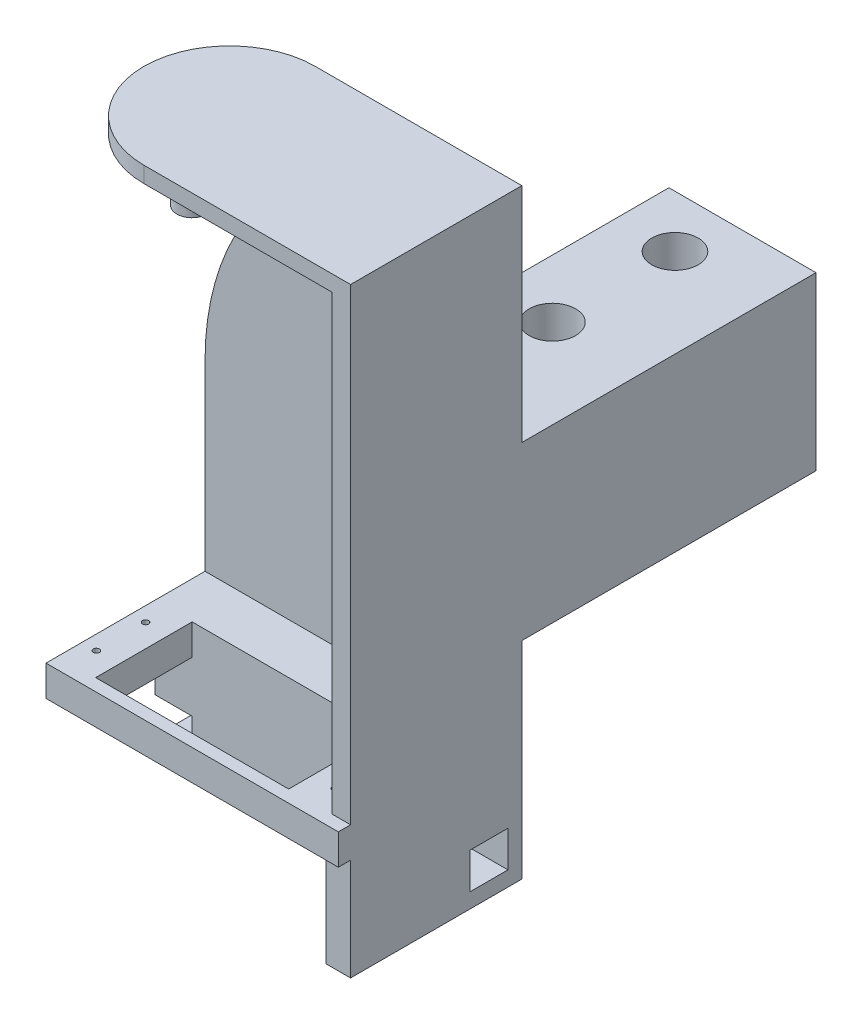
from build123d import *

# Parameters (mm, degrees)
SKETCH1_W            = 55.49400001
SKETCH1_H            = 26.874
BOSS_EXTRUDE1_DEPTH  = 6.35
SKETCH2_W            = 40
SKETCH2_H            = 19
CUT_EXTRUDE1_DEPTH   = 6.35
SKETCH3_R            = 0.635
CUT_EXTRUDE2_DEPTH   = 6.35
SKETCH4_W            = 55.49400001
SKETCH4_H            = 7.874
BOSS_EXTRUDE2_DEPTH  = 21.15
SKETCH6_W            = 7.747000005
SKETCH6_H            = 6.35
BOSS_EXTRUDE3_DEPTH  = 1
SKETCH12_W           = 7.747000005
SKETCH12_H           = 7.475
CUT_EXTRUDE4_DEPTH   = 9.398
SKETCH13_W           = 7.747000005
SKETCH13_H           = 7.9
BOSS_EXTRUDE6_DEPTH  = 20
SKETCH14_W           = 27.874
SKETCH14_H           = 27.5
BOSS_EXTRUDE7_DEPTH  = 5.08
SKETCH16_W           = 3.81
SKETCH16_H           = 27.874
BOSS_EXTRUDE8_DEPTH  = 93.66
BOSS_EXTRUDE9_DEPTH  = 7.62
SKETCH18_W           = 5.08
SKETCH18_H           = 93.66
BOSS_EXTRUDE10_DEPTH = 56.76400001
SKETCH19_W           = 30.48
SKETCH19_H           = 35.56
BOSS_EXTRUDE11_DEPTH = 76.2
SKETCH20_R           = 4.813300002
SKETCH20_R_2         = 4.813299999
CUT_EXTRUDE5_DEPTH   = 76.2
SKETCH21_W           = 30.48
SKETCH21_H           = 35.56
CUT_EXTRUDE6_DEPTH   = 15.24
SKETCH23_W           = 7.876812164
SKETCH23_H           = 7.475
CUT_EXTRUDE7_DEPTH   = 54.102
FILLET1_R            = 55.88
SKETCH24_W           = 3.81
SKETCH24_H           = 35.494
BOSS_EXTRUDE12_DEPTH = 3.302
SKETCH25_W           = 35.494
SKETCH25_H           = 3.302
BOSS_EXTRUDE13_DEPTH = 56.76400001
FILLET2_R            = 17.78
SKETCH26_R           = 3.175
BOSS_EXTRUDE14_DEPTH = 8.89
SKETCH27_W           = 7.747000005
SKETCH27_H           = 20
CUT_EXTRUDE9_DEPTH   = 10.668
SKETCH28_W           = 7.747000005
SKETCH28_H           = 6.35
BOSS_EXTRUDE15_DEPTH = 2.54
SKETCH29_W           = 2.54
SKETCH29_H           = 6.35
BOSS_EXTRUDE16_DEPTH = 47.747000005
SKETCH30_W           = 2.54
SKETCH30_H           = 6.35
BOSS_EXTRUDE17_DEPTH = 5.08


with BuildPart() as part:
    # Sketch1 → Boss-Extrude1 (new body)
    with BuildSketch(Plane(origin=(0, 0, 0), x_dir=(1, 0, 0), z_dir=(0, 1, 0))):
        with Locations((27.747000005, 13.437)):
            Rectangle(SKETCH1_W, SKETCH1_H)
    extrude(amount=BOSS_EXTRUDE1_DEPTH)

    # Sketch2 → Cut-Extrude1 (cut)
    with BuildSketch(Plane(origin=(0, 6.35, 0), x_dir=(1, 0, 0), z_dir=(0, 1, 0))):
        with Locations((27.747000005, 9.5)):
            Rectangle(SKETCH2_W, SKETCH2_H)
    extrude(amount=-CUT_EXTRUDE1_DEPTH, mode=Mode.SUBTRACT)

    # Sketch3 → Cut-Extrude2 (cut)
    with BuildSketch(Plane.XZ):
        with Locations(Location((2.997000004, -14.099999999, 0), (0, 0, 270))):
            Circle(SKETCH3_R)
        with Locations(Location((2.997000004, -3.899999999, 0), (0, 0, 270))):
            Circle(SKETCH3_R)
        with Locations(Location((52.497000004, -14.099999999, 0), (0, 0, 270))):
            Circle(SKETCH3_R)
        with Locations(Location((52.497000004, -3.899999999, 0), (0, 0, 270))):
            Circle(SKETCH3_R)
    extrude(amount=-CUT_EXTRUDE2_DEPTH, mode=Mode.SUBTRACT)

    # Sketch4 → Boss-Extrude2 (add)
    with BuildSketch(Plane.XZ):
        with Locations((27.747000005, -22.937)):
            Rectangle(SKETCH4_W, SKETCH4_H)
    extrude(amount=BOSS_EXTRUDE2_DEPTH)

    # Sketch6 → Boss-Extrude3 (add)
    with BuildSketch(Plane.XY):
        with Locations((3.873500003, 3.175)):
            Rectangle(SKETCH6_W, SKETCH6_H)
        with Locations((51.620500007, 3.175)):
            Rectangle(SKETCH6_W, SKETCH6_H)
    extrude(amount=BOSS_EXTRUDE3_DEPTH)

    # Sketch12 → Cut-Extrude4 (cut)
    with BuildSketch(Plane.XY.offset(-19)):
        with Locations((3.873500003, -14.3125)):
            Rectangle(SKETCH12_W, SKETCH12_H)
    extrude(amount=-CUT_EXTRUDE4_DEPTH, mode=Mode.SUBTRACT)

    # Sketch13 → Boss-Extrude6 (add)
    with BuildSketch(Plane.XY.offset(-19)):
        with Locations((51.620500007, -17.2)):
            Rectangle(SKETCH13_W, SKETCH13_H)
    extrude(amount=BOSS_EXTRUDE6_DEPTH)

    # Sketch14 → Boss-Extrude7 (add)
    with BuildSketch(Plane(origin=(55.49400001, 0, 0), x_dir=(0, 0, -1), z_dir=(1, 0, 0))):
        with Locations((12.937, -7.4)):
            Rectangle(SKETCH14_W, SKETCH14_H)
    extrude(amount=BOSS_EXTRUDE7_DEPTH)

    # Sketch16 → Boss-Extrude8 (add)
    with BuildSketch(Plane(origin=(0, 6.35, 0), x_dir=(1, 0, 0), z_dir=(0, 1, 0))):
        with Locations((58.66900001, 12.937)):
            Rectangle(SKETCH16_W, SKETCH16_H)
    extrude(amount=BOSS_EXTRUDE8_DEPTH)

    # Sketch17 → Boss-Extrude9 (add)
    with BuildSketch(Plane(origin=(0, 0, -26.874), x_dir=(-1, 0, 0), z_dir=(0, 0, -1))):
        Polygon((0, -21.15), (0, -18.05), (-7.747000005, -18.05), (-7.747000005, -10.575), (0, -10.575), (0, 6.35), (-56.76400001, 6.35), (-56.76400001, 100.01), (-60.57400001, 100.01), (-60.57400001, -21.15), align=None)
    extrude(amount=BOSS_EXTRUDE9_DEPTH)

    # Sketch18 → Boss-Extrude10 (add)
    with BuildSketch(Plane.ZY.offset(-56.76400001)):
        with Locations((-31.954, 53.18)):
            Rectangle(SKETCH18_W, SKETCH18_H)
    extrude(amount=BOSS_EXTRUDE10_DEPTH)

    # Sketch19 → Boss-Extrude11 (add)
    with BuildSketch(Plane(origin=(0, 0, -34.494), x_dir=(-1, 0, 0), z_dir=(0, 0, -1))):
        with Locations((-45.33400001, 39.43)):
            Rectangle(SKETCH19_W, SKETCH19_H)
    extrude(amount=BOSS_EXTRUDE11_DEPTH)

    # Sketch20 → Cut-Extrude5 (cut)
    with BuildSketch(Plane.XZ.offset(-21.65)):
        with Locations((42.150157054, -59.253068288)):
            Circle(SKETCH20_R)
        with Locations((42.150157054, -84.653068288)):
            Circle(SKETCH20_R_2)
    extrude(amount=-CUT_EXTRUDE5_DEPTH, mode=Mode.SUBTRACT)

    # Sketch21 → Cut-Extrude6 (cut)
    with BuildSketch(Plane(origin=(0, 0, -110.694), x_dir=(-1, 0, 0), z_dir=(0, 0, -1))):
        with Locations((-45.33400001, 39.43)):
            Rectangle(SKETCH21_W, SKETCH21_H)
    extrude(amount=-CUT_EXTRUDE6_DEPTH, mode=Mode.SUBTRACT)

    # Sketch23 → Cut-Extrude7 (cut)
    with BuildSketch(Plane.ZY.offset(-7.747000005)):
        with Locations((-27.675104405, -14.3125)):
            Rectangle(SKETCH23_W, SKETCH23_H)
    extrude(amount=-CUT_EXTRUDE7_DEPTH, mode=Mode.SUBTRACT)

    # Fillet1
    fillet1_edges = [part.edges().sort_by_distance(p)[0] for p in [
        (0, 100.01, -31.954),
    ]]
    fillet(fillet1_edges, radius=FILLET1_R)

    # Sketch24 → Boss-Extrude12 (add)
    with BuildSketch(Plane(origin=(0, 100.01, 0), x_dir=(1, 0, 0), z_dir=(0, 1, 0))):
        with Locations((58.66900001, 16.747)):
            Rectangle(SKETCH24_W, SKETCH24_H)
    extrude(amount=BOSS_EXTRUDE12_DEPTH)

    # Sketch25 → Boss-Extrude13 (add)
    with BuildSketch(Plane.ZY.offset(-56.76400001)):
        with Locations((-16.747, 101.661)):
            Rectangle(SKETCH25_W, SKETCH25_H)
    extrude(amount=BOSS_EXTRUDE13_DEPTH)

    # Fillet2
    # the kernel refuses this fillet: 17.78 mm, written as the material it takes off along each edge
    with BuildSketch(Plane(origin=(0, 55.56, 1), x_dir=(0, 0, -1), z_dir=(0, 1, 0))) as fillet2_piece_1:
        with BuildLine():
            CenterArc((FILLET2_R, -FILLET2_R), FILLET2_R, 90, 90)
            Line((0, -FILLET2_R), (0, 0))
            Line((0, 0), (FILLET2_R, 0))
        make_face()
    extrude(amount=92.202000001, mode=Mode.SUBTRACT)
    with BuildSketch(Plane(origin=(0, 147.762, -34.494), x_dir=(0, 0, 1), z_dir=(0, -1, 0))) as fillet2_piece_2:
        with BuildLine():
            CenterArc((FILLET2_R, -FILLET2_R), FILLET2_R, 90, 90)
            Line((0, -FILLET2_R), (0, 0))
            Line((0, 0), (FILLET2_R, 0))
        make_face()
    extrude(amount=47.752, mode=Mode.SUBTRACT)

    # Sketch26 → Boss-Extrude14 (add)
    with BuildSketch(Plane(origin=(0, 100.01, 0), x_dir=(1, 0, 0), z_dir=(0, 1, 0))):
        with Locations(Location((17.747000004, 8.999999999, 0), (0, 0, 270))):
            Circle(SKETCH26_R)
    extrude(amount=-BOSS_EXTRUDE14_DEPTH)

    # Sketch27 → Cut-Extrude9 (cut)
    with BuildSketch(Plane.XZ.offset(21.15)):
        with Locations((51.620500007, -9)):
            Rectangle(SKETCH27_W, SKETCH27_H)
    extrude(amount=-CUT_EXTRUDE9_DEPTH, mode=Mode.SUBTRACT)

    # Sketch28 → Boss-Extrude15 (add)
    with BuildSketch(Plane.XY.offset(1)):
        with Locations((51.620500007, 3.175)):
            Rectangle(SKETCH28_W, SKETCH28_H)
    extrude(amount=BOSS_EXTRUDE15_DEPTH)

    # Sketch29 → Boss-Extrude16 (add)
    with BuildSketch(Plane.ZY.offset(-47.747000005)):
        with Locations((2.27, 3.175)):
            Rectangle(SKETCH29_W, SKETCH29_H)
    extrude(amount=BOSS_EXTRUDE16_DEPTH)

    # Sketch30 → Boss-Extrude17 (add)
    with BuildSketch(Plane(origin=(55.49400001, 0, 0), x_dir=(0, 0, -1), z_dir=(1, 0, 0))):
        with Locations((-2.27, 3.175)):
            Rectangle(SKETCH30_W, SKETCH30_H)
    extrude(amount=BOSS_EXTRUDE17_DEPTH)


solid = part.part
